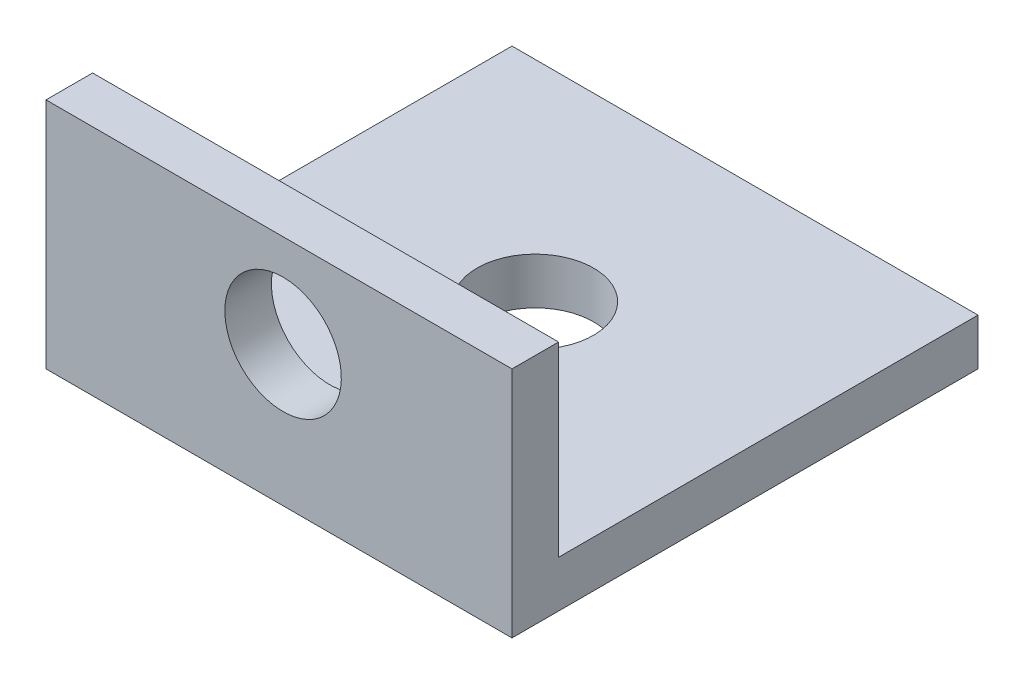
from build123d import *

# Parameters (mm, degrees)
BOSS_EXTRUDE1_DEPTH = 20
SKETCH2_R           = 2.5
CUT_EXTRUDE1_DEPTH  = 2
SKETCH3_R           = 2.5
CUT_EXTRUDE2_DEPTH  = 2


with BuildPart() as part:
    # Sketch1 → Boss-Extrude1 (new body)
    with BuildSketch(Plane(origin=(0, 0, 0), x_dir=(0, 0, -1), z_dir=(1, 0, 0))):
        Polygon((0, 10), (0, 0), (20, 0), (20, 2), (2, 2), (2, 10), align=None)
    extrude(amount=BOSS_EXTRUDE1_DEPTH)

    # Sketch2 → Cut-Extrude1 (cut)
    with BuildSketch(Plane(origin=(0, 0, -2), x_dir=(-1, 0, 0), z_dir=(0, 0, -1))):
        with Locations((-10.174868447, 6)):
            Circle(SKETCH2_R)
    extrude(amount=-CUT_EXTRUDE1_DEPTH, mode=Mode.SUBTRACT)

    # Sketch3 → Cut-Extrude2 (cut)
    with BuildSketch(Plane(origin=(0, 2, 0), x_dir=(1, 0, 0), z_dir=(0, 1, 0))):
        with Locations((10, 11)):
            Circle(SKETCH3_R)
    extrude(amount=-CUT_EXTRUDE2_DEPTH, mode=Mode.SUBTRACT)


solid = part.part
